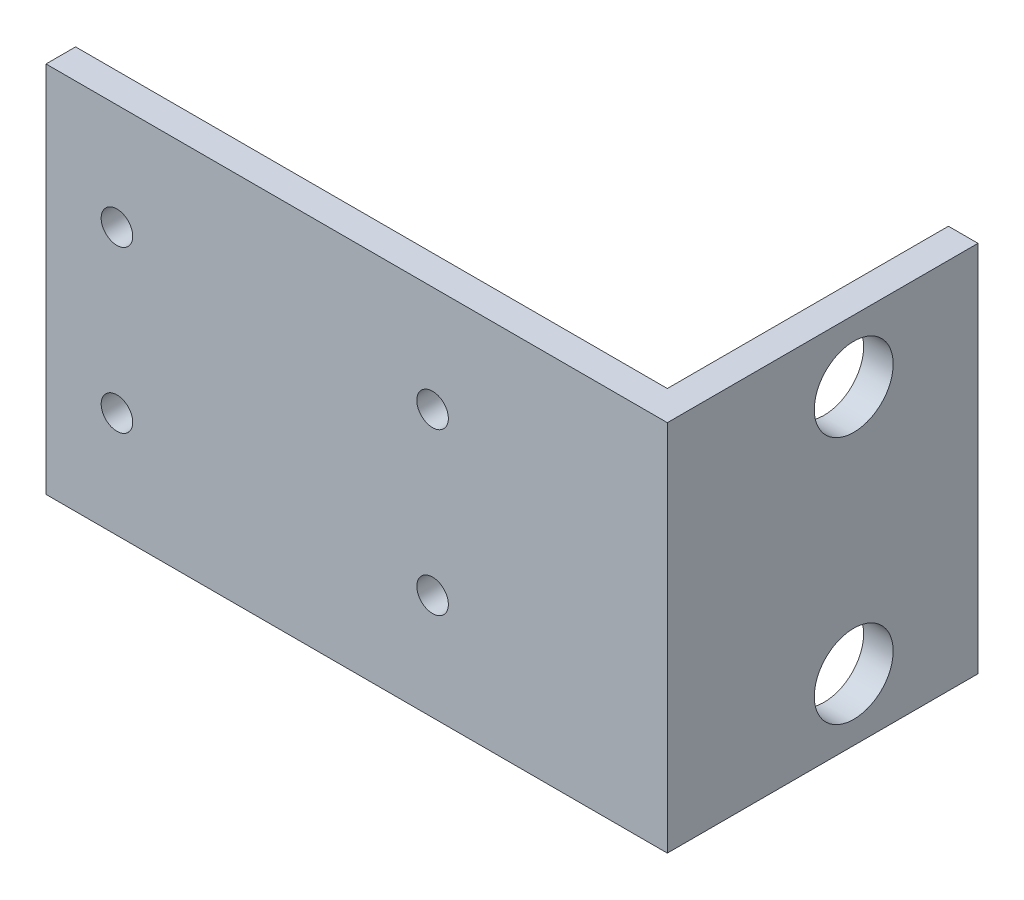
from build123d import *

# Parameters (mm, degrees)
BOSS_EXTRUDE1_DEPTH = 30
SKETCH2_R           = 1.27
CUT_EXTRUDE1_DEPTH  = 62.583645163
SKETCH3_R           = 3.175
CUT_EXTRUDE2_DEPTH  = 63.542848125


with BuildPart() as part:
    # Sketch1 → Boss-Extrude1 (new body)
    with BuildSketch(Plane(origin=(0, 0, 0), x_dir=(1, 0, 0), z_dir=(0, 1, 0))):
        Polygon((0, 0), (0, 22.61875), (2.38125, 22.61875), (2.38125, -2.38125), (-47.61875, -2.38125), (-47.61875, 0), align=None)
    extrude(amount=BOSS_EXTRUDE1_DEPTH)

    # Sketch2 → Cut-Extrude1 (cut, through all)
    with BuildSketch(Plane.XY.offset(2.38125)):
        with Locations((-41.91, 8.523)):
            Circle(SKETCH2_R)
        with Locations((-16.51, 8.523)):
            Circle(SKETCH2_R)
        with Locations((-16.51, 21.477)):
            Circle(SKETCH2_R)
        with Locations((-41.91, 21.477)):
            Circle(SKETCH2_R)
    extrude(amount=-CUT_EXTRUDE1_DEPTH, mode=Mode.SUBTRACT)

    # Sketch3 → Cut-Extrude2 (cut, through all)
    with BuildSketch(Plane(origin=(2.38125, 0, 0), x_dir=(0, 0, -1), z_dir=(1, 0, 0))):
        with Locations((12.61875, 25)):
            Circle(SKETCH3_R)
        with Locations((12.61875, 5)):
            Circle(SKETCH3_R)
    extrude(amount=-CUT_EXTRUDE2_DEPTH, mode=Mode.SUBTRACT)


solid = part.part
